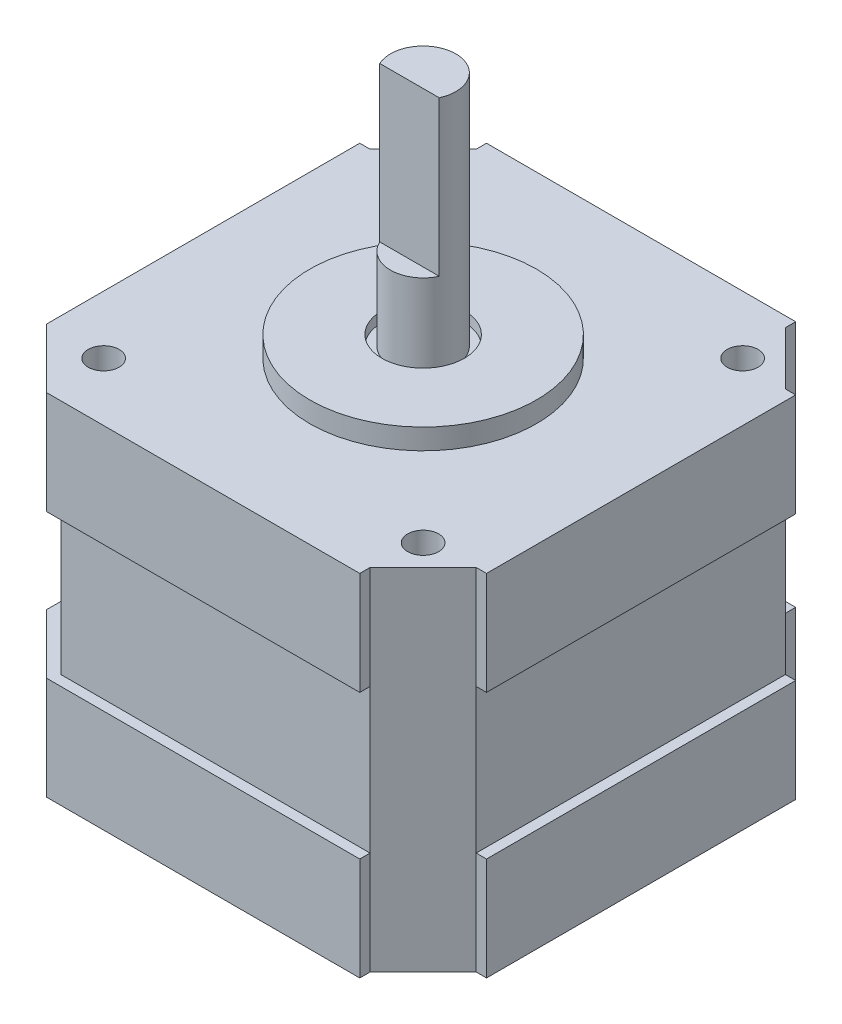
from build123d import *

# Parameters (mm, degrees)
EXTRUSION1_DEPTH      = 17
EXTRUSION1_DEPTH_BACK = 17
SKETCH2_R             = 11
EXTRUSION3_DEPTH      = 2
SKETCH3_R             = 4
EXTRUSION4_DEPTH      = 1
SKETCH4_R             = 3.175
EXTRUSION5_DEPTH      = 23
SKETCH5_W             = 30
SKETCH5_H             = 10
EXTRUSION6_DEPTH      = 1
SKETCH6_W             = 30
SKETCH6_H             = 10
EXTRUSION7_DEPTH      = 1
SKETCH7_W             = 7.283199846
SKETCH7_H             = 10
EXTRUSION8_DEPTH      = 1
EXTRUSION9_START      = -17
EXTRUSION9_DEPTH      = 10
EXTRUSION9_START_2    = 7
EXTRUSION9_2_DEPTH    = 10
EXTRUSION10_START     = -17
EXTRUSION10_DEPTH     = 10
EXTRUSION10_START_2   = 7
EXTRUSION10_2_DEPTH   = 10
HOLE3_D               = 3
HOLE3_DEPTH           = 4.5
EXTRUSION12_START     = -15
EXTRUSION12_DEPTH     = 15


# Read off the part's stored shape, not the designer's step: Extrusion9, Extrusion10
with BuildPart() as part:
    # Sketch1 → Extrusion1 (new, two sides: drawn at the far end of the back side and taken through both)
    with BuildSketch(Plane(origin=(0, 0, 0), x_dir=(-1, 0, 0), z_dir=(0, 1, 0)).offset(-EXTRUSION1_DEPTH_BACK)):
        Polygon((15, 20.15), (20.15, 15), (20.15, -15), (15, -20.15), (-15, -20.15), (-20.15, -15), (-20.15, 15), (-15, 20.15), align=None)
    extrude(amount=EXTRUSION1_DEPTH + EXTRUSION1_DEPTH_BACK)

    # Sketch2 → Extrusion3 (add)
    with BuildSketch(Plane(origin=(0, 17, 0), x_dir=(-1, 0, 0), z_dir=(0, 1, 0))):
        with Locations(Location((0, 0, 0), (0, 0, 90))):
            Circle(SKETCH2_R)
    extrude(amount=EXTRUSION3_DEPTH)

    # Sketch3 → Extrusion4 (cut)
    with BuildSketch(Plane(origin=(0, 19, 0), x_dir=(-1, 0, 0), z_dir=(0, 1, 0))):
        with Locations(Location((0, 0, 0), (0, 0, 90))):
            Circle(SKETCH3_R)
    extrude(amount=-EXTRUSION4_DEPTH, mode=Mode.SUBTRACT)

    # Sketch4 → Extrusion5 (add)
    with BuildSketch(Plane(origin=(0, 18, 0), x_dir=(-1, 0, 0), z_dir=(0, 1, 0))):
        with Locations(Location((0, 0, 0), (0, 0, 90))):
            Circle(SKETCH4_R)
    extrude(amount=EXTRUSION5_DEPTH)

    # Sketch5 → Extrusion6 (add)
    with BuildSketch(Plane.XY.offset(20.15)):
        with Locations((0, 12)):
            Rectangle(SKETCH5_W, SKETCH5_H)
        with Locations((0, -12)):
            Rectangle(SKETCH5_W, SKETCH5_H)
    extrusion6 = extrude(amount=EXTRUSION6_DEPTH)

    # Mirror1: Extrusion6 across plane
    add(extrusion6.mirror(Plane.XY))

    # Sketch6 → Extrusion7 (add)
    with BuildSketch(Plane(origin=(20.15, 0, 0), x_dir=(0, 0, -1), z_dir=(1, 0, 0))):
        with Locations((0, 12)):
            Rectangle(SKETCH6_W, SKETCH6_H)
        with Locations((0, -12)):
            Rectangle(SKETCH6_W, SKETCH6_H)
    extrusion7 = extrude(amount=EXTRUSION7_DEPTH)

    # Mirror2: Extrusion7 across plane
    add(extrusion7.mirror(Plane(origin=(0, 0, 0), x_dir=(0, 0, 1), z_dir=(1, 0, 0))))

    # Sketch7 → Extrusion8 (add)
    with BuildSketch(Plane(origin=(-17.575, 0, 17.575), x_dir=(0.7071067811865475, 0, 0.7071067811865477), z_dir=(-0.7071067811865477, 0, 0.7071067811865475))):
        with Locations((0, 12)):
            Rectangle(SKETCH7_W, SKETCH7_H)
        with Locations((0, -12)):
            Rectangle(SKETCH7_W, SKETCH7_H)
    extrude(amount=EXTRUSION8_DEPTH)

    # Extrusion9 outline → Extrusion9 (add)
    with BuildSketch(Plane(origin=(0, 0, 0), x_dir=(1, 0, 0), z_dir=(0, 1, 0)).offset(EXTRUSION9_START)):
        Polygon((-15.414213562, -21.15), (-15, -21.15), (-15, -20.15), (-15.707106781, -20.857106781), align=None)
    extrude(amount=EXTRUSION9_DEPTH)

    # Extrusion9 2 outline → Extrusion9 2 (add)
    with BuildSketch(Plane(origin=(0, 0, 0), x_dir=(1, 0, 0), z_dir=(0, 1, 0)).offset(EXTRUSION9_START_2)):
        Polygon((-15.414213562, -21.15), (-15, -21.15), (-15, -20.15), (-15.707106781, -20.857106781), align=None)
    extrude(amount=EXTRUSION9_2_DEPTH)

    # Extrusion10 outline → Extrusion10 (add)
    with BuildSketch(Plane(origin=(0, 0, 0), x_dir=(1, 0, 0), z_dir=(0, 1, 0)).offset(EXTRUSION10_START)):
        Polygon((-20.15, -15), (-21.15, -15), (-21.15, -15.414213562), (-20.857106781, -15.707106781), align=None)
    extrude(amount=EXTRUSION10_DEPTH)

    # Extrusion10 2 outline → Extrusion10 2 (add)
    with BuildSketch(Plane(origin=(0, 0, 0), x_dir=(1, 0, 0), z_dir=(0, 1, 0)).offset(EXTRUSION10_START_2)):
        Polygon((-20.15, -15), (-21.15, -15), (-21.15, -15.414213562), (-20.857106781, -15.707106781), align=None)
    extrude(amount=EXTRUSION10_2_DEPTH)

    # Hole3
    with Locations(Plane(origin=(0, 17, 0), x_dir=(1, 0, 0), z_dir=(0, 1, 0))):
        with Locations((-15.5, -15.5), (-15.5, 15.5), (15.5, 15.5), (15.5, -15.5)):
            Hole(HOLE3_D / 2, depth=HOLE3_DEPTH)

    # Sketch12 → Extrusion12 (cut)
    with BuildSketch(Plane(origin=(0, 41, 0), x_dir=(-1, 0, 0), z_dir=(0, 1, 0)).offset(EXTRUSION12_START)):
        with BuildLine():
            Line((-2.885307609, 1.325), (2.885307609, 1.325))
            ThreePointArc((2.885307609, 1.325), (0, 3.175), (-2.885307609, 1.325))
        make_face()
    extrude(amount=EXTRUSION12_DEPTH, mode=Mode.SUBTRACT)


solid = part.part
